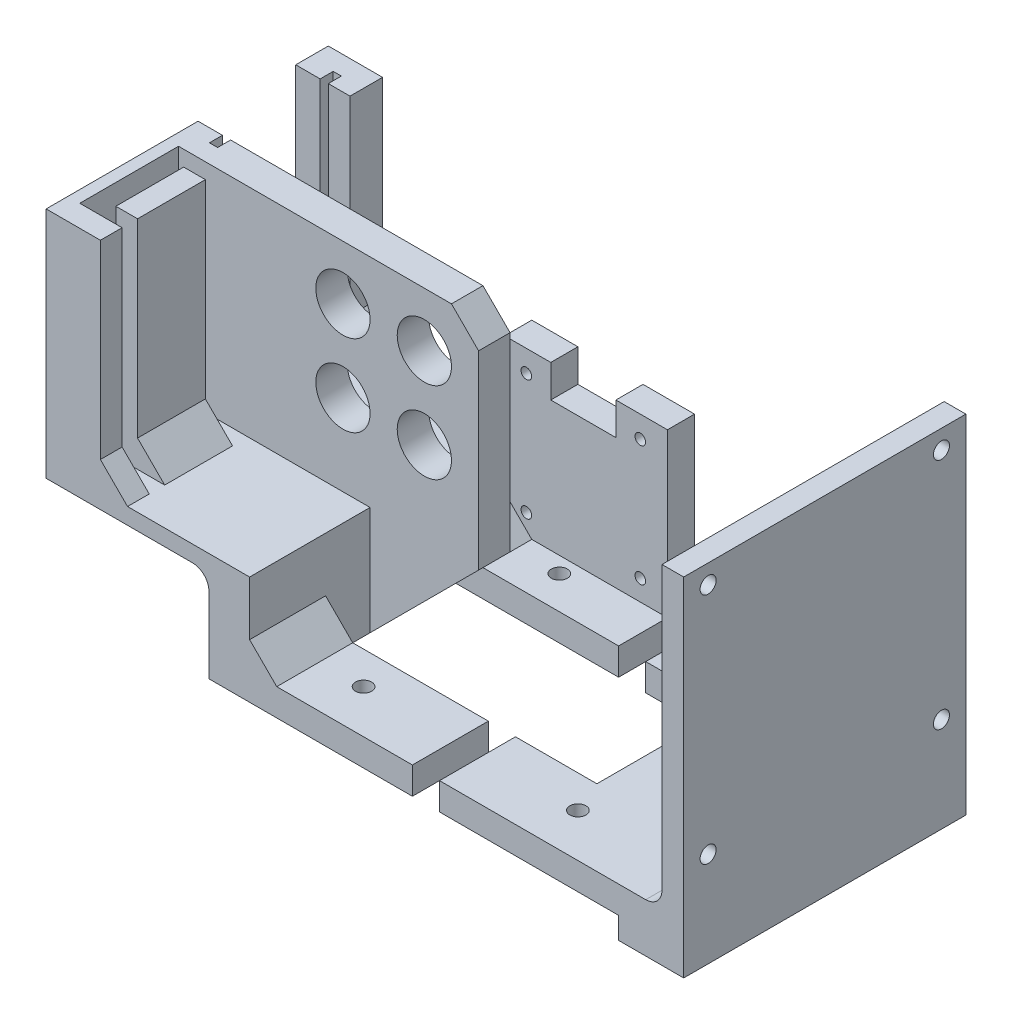
from build123d import *

# Parameters (mm, degrees)
SKETCH_1_W           = 87.5
SKETCH_1_H           = 62
EXTRUDE_1_DEPTH      = 60
SKETCH_2_W           = 12
SKETCH_2_H           = 62
EXTRUDE_2_DEPTH      = 4
SKETCH_4_R           = 1.48
SKETCH_4_W           = 10
SKETCH_4_H           = 12
SKETCH_4_W_2         = 50
SKETCH_4_H_2         = 24
CUT_EXTRUDE_2_DEPTH  = 10
SKETCH_6_W           = 87.5
SKETCH_6_H           = 5
CUT_EXTRUDE_3_DEPTH  = 100
SKETCH_7_W           = 52
SKETCH_7_H           = 43
EXTRUDE_3_DEPTH      = 30
SKETCH_9_W           = 103.5
SKETCH_9_H           = 52
CUT_EXTRUDE_4_DEPTH  = 40
SKETCH_10_W          = 76
SKETCH_10_H          = 52
CUT_EXTRUDE_5_DEPTH  = 15
SKETCH_11_R          = 1.48
CUT_EXTRUDE_6_DEPTH  = 10
CUT_EXTRUDE_7_DEPTH  = 40
SKETCH_12_4_W        = 4
SKETCH_12_4_H        = 18
SKETCH_12_4_W_2      = 4.5
CUT_EXTRUDE_8_DEPTH  = 40
SKETCH_13_W          = 27.5
SKETCH_13_H          = 5.8
EXTRUDE_4_DEPTH      = 40
SKETCH_14_W          = 30
SKETCH_14_H          = 5
EXTRUDE_5_DEPTH      = 30
SKETCH_15_R          = 0.98
SKETCH_15_W          = 12
SKETCH_15_H          = 6
CUT_EXTRUDE_9_DEPTH  = 10
FILLET_2_R           = 3
SKETCH_16_W          = 5
SKETCH_16_H          = 14
CUT_EXTRUDE_10_DEPTH = 10
CHAMFER_4_SIZE       = 5
SKETCH_17_W          = 5.8
SKETCH_17_H          = 40
EXTRUDE_6_DEPTH      = 20
CHAMFER_5_SIZE       = 20
CHAMFER_6_SIZE       = 5
SKETCH_18_R          = 5
CUT_EXTRUDE_11_DEPTH = 20
FILLET_3_R           = 3


with BuildPart() as part:
    # 草图1 → 凸台-拉伸1 (new body)
    with BuildSketch(Plane(origin=(0, 0, 0), x_dir=(1, 0, 0), z_dir=(0, 1, 0))):
        Rectangle(SKETCH_1_W, SKETCH_1_H)
    extrude(amount=EXTRUDE_1_DEPTH)

    # 草图2 → 凸台-拉伸2 (add)
    with BuildSketch(Plane.XZ):
        with Locations((37.75, 0)):
            Rectangle(SKETCH_2_W, SKETCH_2_H)
    extrude(amount=EXTRUDE_2_DEPTH)

    # 草图4 → 切除-拉伸2 (cut)
    with BuildSketch(Plane.XZ):
        with Locations(Location((16.25, -18, 0), (0, 0, 270))):
            Circle(SKETCH_4_R)
        with Locations(Location((-23.25, -18.075939793, 0), (0, 0, 270))):
            Circle(SKETCH_4_R)
        with Locations(Location((-23.25, 18, 0), (0, 0, 270))):
            Circle(SKETCH_4_R)
        with Locations(Location((16.25, 18, 0), (0, 0, 270))):
            Circle(SKETCH_4_R)
        with Locations((24.75, 0)):
            Rectangle(SKETCH_4_W, SKETCH_4_H)
        with Locations((-11.25, 0)):
            Rectangle(SKETCH_4_W_2, SKETCH_4_H_2)
    extrude(amount=-CUT_EXTRUDE_2_DEPTH, mode=Mode.SUBTRACT)

    # 草图6 → 切除-拉伸3 (cut)
    with BuildSketch(Plane(origin=(0, 60, 0), x_dir=(1, 0, 0), z_dir=(0, 1, 0))):
        with Locations((0, -28.5)):
            Rectangle(SKETCH_6_W, SKETCH_6_H)
        with Locations((0, 28.5)):
            Rectangle(SKETCH_6_W, SKETCH_6_H)
    extrude(amount=-CUT_EXTRUDE_3_DEPTH, mode=Mode.SUBTRACT)

    # 草图7 → 凸台-拉伸3 (add)
    with BuildSketch(Plane.ZY.offset(43.75)):
        with Locations((0, 38.5)):
            Rectangle(SKETCH_7_W, SKETCH_7_H)
    extrude(amount=EXTRUDE_3_DEPTH)

    # 草图9 → 切除-拉伸4 (cut)
    with BuildSketch(Plane(origin=(0, 60, 0), x_dir=(1, 0, 0), z_dir=(0, 1, 0))):
        with Locations((-12, 0)):
            Rectangle(SKETCH_9_W, SKETCH_9_H)
    extrude(amount=-CUT_EXTRUDE_4_DEPTH, mode=Mode.SUBTRACT)

    # 草图10 → 切除-拉伸5 (cut)
    with BuildSketch(Plane(origin=(0, 20, 0), x_dir=(1, 0, 0), z_dir=(0, 1, 0))):
        with Locations((1.75, 0)):
            Rectangle(SKETCH_10_W, SKETCH_10_H)
    extrude(amount=-CUT_EXTRUDE_5_DEPTH, mode=Mode.SUBTRACT)

    # 草图11 → 切除-拉伸6 (cut)
    with BuildSketch(Plane(origin=(43.75, 0, 0), x_dir=(0, 0, -1), z_dir=(1, 0, 0))):
        with Locations((-21.5, 56.5)):
            Circle(SKETCH_11_R)
        with Locations((21.5, 56.5)):
            Circle(SKETCH_11_R)
        with Locations((-21.5, 13.5)):
            Circle(SKETCH_11_R)
        with Locations((21.5, 13.5)):
            Circle(SKETCH_11_R)
    extrude(amount=-CUT_EXTRUDE_6_DEPTH, mode=Mode.SUBTRACT)

    # 草图12 → 切除-拉伸7 (cut)
    with BuildSketch(Plane(origin=(0, 60, 0), x_dir=(1, 0, 0), z_dir=(0, 1, 0))):
        Polygon((-63.75, -22), (-63.75, -19.15), (-67.75, -19.15), (-67.75, -6.65), (-63.75, -6.65), (-63.75, -3.8), (-71.55, -3.8), (-71.55, -22), align=None)
    extrude(amount=-CUT_EXTRUDE_7_DEPTH, mode=Mode.SUBTRACT)

    # 草图12<4> → 切除-拉伸8 (cut)
    with BuildSketch(Plane(origin=(0, 60, 0), x_dir=(1, 0, 0), z_dir=(0, 1, 0))):
        Polygon((-67.75, -0.4), (-67.75, 2), (-67.75, 20), (-67.75, 22.4), (-69.25, 22.4), (-69.25, 20), (-69.25, 2), (-69.25, -0.4), align=None)
        with Locations((-65.75, 11)):
            Rectangle(SKETCH_12_4_W, SKETCH_12_4_H)
        with Locations((-71.5, 11)):
            Rectangle(SKETCH_12_4_W_2, SKETCH_12_4_H)
    extrude(amount=-CUT_EXTRUDE_8_DEPTH, mode=Mode.SUBTRACT)

    # 草图13 → 凸台-拉伸4 (add)
    with BuildSketch(Plane(origin=(0, 20, 0), x_dir=(1, 0, 0), z_dir=(0, 1, 0))):
        with Locations((-50, -0.9)):
            Rectangle(SKETCH_13_W, SKETCH_13_H)
    extrude(amount=EXTRUDE_4_DEPTH)

    # 草图14 → 凸台-拉伸5 (add)
    with BuildSketch(Plane(origin=(0, 5, 0), x_dir=(1, 0, 0), z_dir=(0, 1, 0))):
        with Locations((-21.25, 23.5)):
            Rectangle(SKETCH_14_W, SKETCH_14_H)
    extrude(amount=EXTRUDE_5_DEPTH)

    # 草图15 → 切除-拉伸9 (cut)
    with BuildSketch(Plane(origin=(0, 0, -26), x_dir=(-1, 0, 0), z_dir=(0, 0, -1))):
        with Locations((11.25, 31)):
            Circle(SKETCH_15_R)
        with Locations((32.25, 31)):
            Circle(SKETCH_15_R)
        with Locations((11.25, 8.8)):
            Circle(SKETCH_15_R)
        with Locations((32.25, 8.8)):
            Circle(SKETCH_15_R)
        with Locations((21.75, 32)):
            Rectangle(SKETCH_15_W, SKETCH_15_H)
    extrude(amount=-CUT_EXTRUDE_9_DEPTH, mode=Mode.SUBTRACT)

    # 圆角2
    fillet_2_edges = [part.edges().sort_by_distance(p)[0] for p in [
        (-43.75, 17, 0),
    ]]
    fillet(fillet_2_edges, radius=FILLET_2_R)

    # 草图16 → 切除-拉伸10 (cut)
    with BuildSketch(Plane(origin=(0, 5, 0), x_dir=(1, 0, 0), z_dir=(0, 1, 0))):
        with Locations((-3.75, -19)):
            Rectangle(SKETCH_16_W, SKETCH_16_H)
        with Locations((-3.75, 19)):
            Rectangle(SKETCH_16_W, SKETCH_16_H)
    extrude(amount=-CUT_EXTRUDE_10_DEPTH, mode=Mode.SUBTRACT)


with BuildPart() as cut_extrude_10_piece_1:
    # of the separate pieces the step leaves, piece 1, a body of its own (cut_extrude_10_pieces)
    add(part.part.solids().sort_by_distance((-43.75, 14, -26))[0])

    # 倒角4
    chamfer_4_edges = [cut_extrude_10_piece_1.edges().sort_by_distance(p)[0] for p in [
        (-36.25, 20, -23.5),
        (-36.25, 5, 19),
        (-36.25, 5, -16.5),
        (-63.75, 20, 12.9),
        (-63.75, 20, 24),
        (-63.75, 20, -23),
    ]]
    chamfer(chamfer_4_edges, length=CHAMFER_4_SIZE)

    # 草图17 → 凸台-拉伸6 (add)
    with BuildSketch(Plane(origin=(-36.25, 0, 0), x_dir=(0, 0, -1), z_dir=(1, 0, 0))):
        with Locations((-0.9, 40)):
            Rectangle(SKETCH_17_W, SKETCH_17_H)
    extrude(amount=EXTRUDE_6_DEPTH)

    # 倒角5
    chamfer_5_edges = [cut_extrude_10_piece_1.edges().sort_by_distance(p)[0] for p in [
        (-36.25, 20, 0.9),
    ]]
    chamfer(chamfer_5_edges, length=CHAMFER_5_SIZE - 0.0001)  # a hair under: the kernel refuses the full size

    # 倒角6
    chamfer_6_edges = [cut_extrude_10_piece_1.edges().sort_by_distance(p)[0] for p in [
        (-16.25, 60, 0.9),
    ]]
    chamfer(chamfer_6_edges, length=CHAMFER_6_SIZE)

    # 草图18 → 切除-拉伸11 (cut)
    with BuildSketch(Plane(origin=(0, 0, -2), x_dir=(-1, 0, 0), z_dir=(0, 0, -1))):
        with Locations((26.25, 50)):
            Circle(SKETCH_18_R)
        with Locations((41.25, 50)):
            Circle(SKETCH_18_R)
        with Locations((26.25, 35)):
            Circle(SKETCH_18_R)
        with Locations((41.25, 35)):
            Circle(SKETCH_18_R)
    extrude(amount=-CUT_EXTRUDE_11_DEPTH, mode=Mode.SUBTRACT)


with BuildPart() as cut_extrude_10_piece_2:
    # of the separate pieces the step leaves, piece 2, a body of its own (cut_extrude_10_pieces)
    add(part.part.solids().sort_by_distance((-1.25, 0, -26))[0])

    # 圆角3
    fillet_3_edges = [cut_extrude_10_piece_2.edges().sort_by_distance(p)[0] for p in [
        (39.75, 5, 0),
    ]]
    fillet(fillet_3_edges, radius=FILLET_3_R)


solid = Compound([cut_extrude_10_piece_1.part, cut_extrude_10_piece_2.part])
